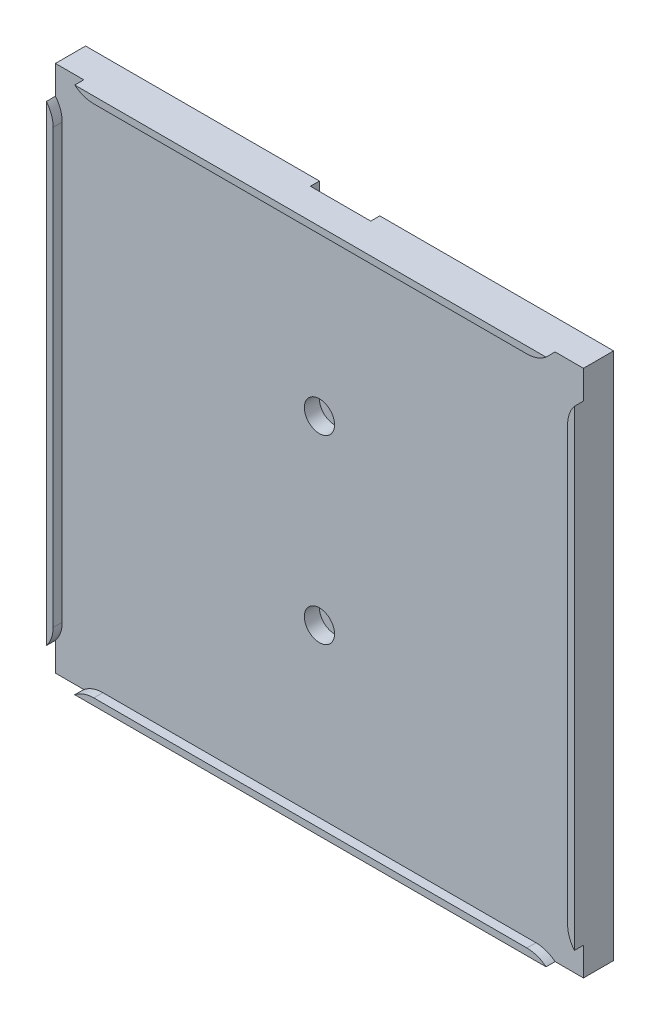
from build123d import *

# Parameters (mm, degrees)
SKETCH_1_W           = 175
SKETCH_1_H           = 175
EXTRUDE_1_DEPTH      = 20
SKETCH_2_W           = 175
SKETCH_2_H           = 175
SKETCH_2_W_2         = 170.15
SKETCH_2_H_2         = 170.15
EXTRUDE_2_DEPTH      = 3
SKETCH_3_R           = 2
CUT_EXTRUDE_1_DEPTH  = 74
SKETCH_4_R           = 5
CUT_EXTRUDE_2_DEPTH  = 5
SKETCH_5_W           = 20
SKETCH_5_H           = 175
CUT_EXTRUDE_3_DEPTH  = 10
CUT_EXTRUDE_4_DEPTH  = 18
OTHER_1_DEPTH        = 18
SKETCH_7_W           = 175
SKETCH_7_H           = 175
CUT_EXTRUDE_5_DEPTH  = 61
SKETCH_9_W           = 20
SKETCH_9_H           = 175
CUT_EXTRUDE_7_DEPTH  = 3
SKETCH_10_W          = 9
SKETCH_10_H          = 169
CUT_EXTRUDE_8_DEPTH  = 9
SKETCH_11_W          = 170.5
SKETCH_11_H          = 170.5
CUT_EXTRUDE_9_DEPTH  = 101
SKETCH_12_R          = 7.5
CUT_EXTRUDE_10_DEPTH = 89
FILLET_1_R           = 10
FILLET_2_R           = 10


# Read off the part's stored shape, not the designer's step: 填充阵列1
with BuildPart() as part:
    # 草图1 → 凸台-拉伸1 (new body)
    with BuildSketch(Plane.XY):
        Rectangle(SKETCH_1_W, SKETCH_1_H)
    extrude(amount=EXTRUDE_1_DEPTH)

    # 草图2 → 凸台-拉伸2 (add)
    with BuildSketch(Plane.XY.offset(20)):
        Rectangle(SKETCH_2_W, SKETCH_2_H)
        Rectangle(SKETCH_2_W_2, SKETCH_2_H_2, mode=Mode.SUBTRACT)
    extrude(amount=EXTRUDE_2_DEPTH)

    # 草图3 → 切除-拉伸1 (cut)
    with BuildSketch(Plane.XY.offset(20)):
        with Locations((0, 30)):
            Circle(SKETCH_3_R)
        with Locations((0, -30)):
            Circle(SKETCH_3_R)
    extrude(amount=-CUT_EXTRUDE_1_DEPTH, mode=Mode.SUBTRACT)

    # 草图4 → 切除-拉伸2 (cut)
    with BuildSketch(Plane.XY.offset(20)):
        with Locations((0, 30)):
            Circle(SKETCH_4_R)
        with Locations((0, -30)):
            Circle(SKETCH_4_R)
    extrude(amount=-CUT_EXTRUDE_2_DEPTH, mode=Mode.SUBTRACT)

    # 草图5 → 切除-拉伸3 (cut)
    with BuildSketch(Plane(origin=(0, 0, 0), x_dir=(-1, 0, 0), z_dir=(0, 0, -1))):
        Rectangle(SKETCH_5_W, SKETCH_5_H)
    extrude(amount=-CUT_EXTRUDE_3_DEPTH, mode=Mode.SUBTRACT)

    # 草图6 → 切除-拉伸4 (cut)
    with BuildSketch(Plane(origin=(0, 0, 0), x_dir=(-1, 0, 0), z_dir=(0, 0, -1))):
        Polygon((40.349883702, 10), (34.57638101, 0), (40.349883702, -10), (51.896889086, -10), (57.670391778, 0), (51.896889086, 10), align=None)
    cut_extrude_4 = extrude(amount=-CUT_EXTRUDE_4_DEPTH, mode=Mode.SUBTRACT)

    # 填充阵列1 outline → 填充阵列1 (cut)
    with BuildSketch(Plane.XY):
        Polygon((-58.536417182, -21.5), (-70.083422566, -21.5), (-75.856925258, -31.5), (-70.083422566, -41.5), (-58.536417182, -41.5), (-52.76291449, -31.5), align=None)
        Polygon((-22.163350223, 41.5), (-33.710355607, 41.5), (-39.483858299, 31.5), (-33.710355607, 21.5), (-22.163350223, 21.5), (-16.389847531, 31.5), align=None)
        Polygon((-33.710355607, -21.5), (-39.483858299, -31.5), (-33.710355607, -41.5), (-22.163350223, -41.5), (-16.389847531, -31.5), (-22.163350223, -21.5), align=None)
        Polygon((-70.083422566, 41.5), (-75.856925258, 31.5), (-70.083422566, 21.5), (-58.536417182, 21.5), (-52.76291449, 31.5), (-58.536417182, 41.5), align=None)
        Polygon((-16.389847531, -73.5), (-22.163350223, -63.5), (-33.710355607, -63.5), (-39.483858299, -73.5), (-33.710355607, -83.5), (-22.163350223, -83.5), align=None)
        Polygon((-52.76291449, -73.5), (-58.536417182, -63.5), (-70.083422566, -63.5), (-75.856925258, -73.5), (-70.083422566, -83.5), (-58.536417182, -83.5), align=None)
        Polygon((-51.896889086, -32), (-57.670391778, -42), (-51.896889086, -52), (-40.349883702, -52), (-34.57638101, -42), (-40.349883702, -32), align=None)
        Polygon((-70.083422566, -0.5), (-75.856925258, -10.5), (-70.083422566, -20.5), (-58.536417182, -20.5), (-52.76291449, -10.5), (-58.536417182, -0.5), align=None)
        Polygon((-34.57638101, 63), (-40.349883702, 73), (-51.896889086, 73), (-57.670391778, 63), (-51.896889086, 53), (-40.349883702, 53), align=None)
        Polygon((-16.389847531, 73.5), (-22.163350223, 83.5), (-33.710355607, 83.5), (-39.483858299, 73.5), (-33.710355607, 63.5), (-22.163350223, 63.5), align=None)
        Polygon((-52.76291449, 73.5), (-58.536417182, 83.5), (-70.083422566, 83.5), (-75.856925258, 73.5), (-70.083422566, 63.5), (-58.536417182, 63.5), align=None)
        Polygon((-40.349883702, 52), (-51.896889086, 52), (-57.670391778, 42), (-51.896889086, 32), (-40.349883702, 32), (-34.57638101, 42), align=None)
        Polygon((-58.536417182, 20.5), (-70.083422566, 20.5), (-75.856925258, 10.5), (-70.083422566, 0.5), (-58.536417182, 0.5), (-52.76291449, 10.5), align=None)
        Polygon((-52.76291449, 52.5), (-58.536417182, 62.5), (-70.083422566, 62.5), (-75.856925258, 52.5), (-70.083422566, 42.5), (-58.536417182, 42.5), align=None)
        Polygon((-16.389847531, 52.5), (-22.163350223, 62.5), (-33.710355607, 62.5), (-39.483858299, 52.5), (-33.710355607, 42.5), (-22.163350223, 42.5), align=None)
        Polygon((-51.896889086, 31), (-57.670391778, 21), (-51.896889086, 11), (-40.349883702, 11), (-34.57638101, 21), (-40.349883702, 31), align=None)
        Polygon((-33.710355607, -0.5), (-39.483858299, -10.5), (-33.710355607, -20.5), (-22.163350223, -20.5), (-16.389847531, -10.5), (-22.163350223, -0.5), align=None)
        Polygon((-33.710355607, 20.5), (-39.483858299, 10.5), (-33.710355607, 0.5), (-22.163350223, 0.5), (-16.389847531, 10.5), (-22.163350223, 20.5), align=None)
        Polygon((-40.349883702, -53), (-51.896889086, -53), (-57.670391778, -63), (-51.896889086, -73), (-40.349883702, -73), (-34.57638101, -63), align=None)
        Polygon((-34.57638101, -21), (-40.349883702, -11), (-51.896889086, -11), (-57.670391778, -21), (-51.896889086, -31), (-40.349883702, -31), align=None)
        Polygon((-58.536417182, -42.5), (-70.083422566, -42.5), (-75.856925258, -52.5), (-70.083422566, -62.5), (-58.536417182, -62.5), (-52.76291449, -52.5), align=None)
        Polygon((-33.710355607, -42.5), (-39.483858299, -52.5), (-33.710355607, -62.5), (-22.163350223, -62.5), (-16.389847531, -52.5), (-22.163350223, -42.5), align=None)
    other_1 = extrude(amount=OTHER_1_DEPTH, mode=Mode.SUBTRACT)

    # 镜向1: 切除-拉伸4, 填充阵列1 across plane
    add(cut_extrude_4.mirror(Plane(origin=(0, 0, 0), x_dir=(0, 0, 1), z_dir=(1, 0, 0))), mode=Mode.SUBTRACT)
    add(other_1.mirror(Plane(origin=(0, 0, 0), x_dir=(0, 0, 1), z_dir=(1, 0, 0))), mode=Mode.SUBTRACT)

    # 草图7 → 切除-拉伸5 (cut)
    with BuildSketch(Plane(origin=(0, 0, 10), x_dir=(-1, 0, 0), z_dir=(0, 0, -1))):
        Rectangle(SKETCH_7_W, SKETCH_7_H)
    extrude(amount=CUT_EXTRUDE_5_DEPTH, mode=Mode.SUBTRACT)

    # 草图9 → 切除-拉伸7 (cut)
    with BuildSketch(Plane(origin=(0, 0, 10), x_dir=(-1, 0, 0), z_dir=(0, 0, -1))):
        Rectangle(SKETCH_9_W, SKETCH_9_H)
    extrude(amount=-CUT_EXTRUDE_7_DEPTH, mode=Mode.SUBTRACT)

    # 草图10 → 切除-拉伸8 (cut)
    with BuildSketch(Plane(origin=(0, 0, 10), x_dir=(-1, 0, 0), z_dir=(0, 0, -1))):
        with Locations((81, 0)):
            Rectangle(SKETCH_10_W, SKETCH_10_H)
    cut_extrude_8 = extrude(amount=-CUT_EXTRUDE_8_DEPTH, mode=Mode.SUBTRACT)

    # 镜向2: 切除-拉伸8 across plane
    add(cut_extrude_8.mirror(Plane(origin=(0, 0, 0), x_dir=(0, 0, 1), z_dir=(1, 0, 0))), mode=Mode.SUBTRACT)

    # 草图11 → 切除-拉伸9 (cut)
    with BuildSketch(Plane.XY.offset(20)):
        Rectangle(SKETCH_11_W, SKETCH_11_H)
    extrude(amount=CUT_EXTRUDE_9_DEPTH, mode=Mode.SUBTRACT)

    # 草图12 → 切除-拉伸10 (cut)
    with BuildSketch(Plane.XY.offset(20)):
        with Locations((85.25, 85.25)):
            Circle(SKETCH_12_R)
        with Locations((-85.25, 85.25)):
            Circle(SKETCH_12_R)
        with Locations((-85.25, -85.25)):
            Circle(SKETCH_12_R)
        with Locations((85.25, -85.25)):
            Circle(SKETCH_12_R)
    extrude(amount=CUT_EXTRUDE_10_DEPTH, mode=Mode.SUBTRACT)

    # 圆角1
    # the kernel refuses this fillet: 10 mm, written as the material it takes off along each edge
    with BuildSketch(Plane(origin=(77.75, -85.25, 37.935390851), x_dir=(0.1517576992825315, -0.9884177258166066, 0), z_dir=(0, 0, -1)), Plane(origin=(85.25, 77.75, 37.935390851), x_dir=(0.9884177258166073, 0.15175769928252728, 0), z_dir=(0, 0, -1))) as fillet_1_piece_1:
        with BuildLine():
            CenterArc((8.977553037, 7.422539017), FILLET_1_R, 188.728801562, 39.194967426)
            Line((-0.906624221, 5.904962024), (-1.104307767, 5.874610484))
            Line((-1.104307767, 5.874610484), (-0.197683545, -0.03035154))
            Line((-0.197683545, -0.03035154), (0.03035154, -0.197683545))
            ThreePointArc((0.03035154, -0.197683545), (1.138182745, -0.113132944), (2.142341738, -0.14845078))
            Line((2.142341738, -0.14845078), (2.276365489, 0))
        make_face()
    extrude(amount=17.935390851, mode=Mode.SUBTRACT)
    with BuildSketch(Plane(origin=(85.25, -77.75, 37.935390851), x_dir=(0.9884177258166066, -0.1517576992825315, 0), z_dir=(0, 0, -1)), Plane(origin=(77.75, 85.25, 37.935390851), x_dir=(0.1517576992825315, 0.9884177258166066, 0), z_dir=(0, 0, -1))) as fillet_1_piece_2:
        with BuildLine():
            CenterArc((8.977553037, -7.422539017), FILLET_1_R, 132.076231012, 39.194967426)
            Line((-0.906624221, -5.904962024), (-1.104307767, -5.874610484))
            Line((-1.104307767, -5.874610484), (-0.197683545, 0.03035154))
            Line((-0.197683545, 0.03035154), (0.03035154, 0.197683545))
            ThreePointArc((0.03035154, 0.197683545), (1.138182745, 0.113132944), (2.142341738, 0.14845078))
            Line((2.142341738, 0.14845078), (2.276365489, 0))
        make_face()
    extrude(amount=17.935390851, mode=Mode.SUBTRACT)

    # 圆角2
    # the kernel refuses this fillet: 10 mm, written as the material it takes off along each edge
    with BuildSketch(Plane(origin=(-85.25, 77.75, 37.935390851), x_dir=(0, -1, 0), z_dir=(0, 0, -1))) as fillet_2_piece_1:
        with BuildLine():
            CenterArc((5.974156341, 10), FILLET_2_R, 230.805032574, 39.194967426)
            Line((-0.345455989, 2.25), (-0.471848236, 2.095))
            ThreePointArc((-0.471848236, 2.095), (-0.284550602, 1.107831205), (-0.2, 0))
            Line((-0.2, 0), (0, -0.2))
            Line((0, -0.2), (5.974156341, -0.2))
            Line((5.974156341, -0.2), (5.974156341, 0))
        make_face()
    extrude(amount=17.935390851, mode=Mode.SUBTRACT)
    with BuildSketch(Plane(origin=(-77.75, 85.25, 20), x_dir=(-0.15175769928253574, 0.988417725816606, 0), z_dir=(0, 0, 1))) as fillet_2_piece_2:
        with BuildLine():
            CenterArc((8.977553037, -7.422539017), FILLET_2_R, 132.076231012, 39.194967426)
            Line((-0.906624221, -5.904962024), (-1.104307767, -5.874610484))
            Line((-1.104307767, -5.874610484), (-0.197683545, 0.03035154))
            Line((-0.197683545, 0.03035154), (0.03035154, 0.197683545))
            ThreePointArc((0.03035154, 0.197683545), (1.138182745, 0.113132944), (2.142341738, 0.14845078))
            Line((2.142341738, 0.14845078), (2.276365489, 0))
        make_face()
    extrude(amount=17.935390851, mode=Mode.SUBTRACT)
    with BuildSketch(Plane(origin=(-77.75, -85.25, 20), x_dir=(1, 0, 0), z_dir=(0, 0, 1))) as fillet_2_piece_3:
        with BuildLine():
            CenterArc((5.974156341, -10), FILLET_2_R, 90, 39.194967426)
            Line((-0.345455989, -2.25), (-0.471848236, -2.095))
            ThreePointArc((-0.471848236, -2.095), (-0.284550602, -1.107831205), (-0.2, 0))
            Line((-0.2, 0), (0, 0.2))
            Line((0, 0.2), (5.974156341, 0.2))
            Line((5.974156341, 0.2), (5.974156341, 0))
        make_face()
    extrude(amount=17.935390851, mode=Mode.SUBTRACT)
    with BuildSketch(Plane(origin=(-85.25, -77.75, 37.935390851), x_dir=(-0.9884177258166066, -0.1517576992825315, 0), z_dir=(0, 0, -1))) as fillet_2_piece_4:
        with BuildLine():
            CenterArc((8.977553037, 7.422539017), FILLET_2_R, 188.728801562, 39.194967426)
            Line((-0.906624221, 5.904962024), (-1.104307767, 5.874610484))
            Line((-1.104307767, 5.874610484), (-0.197683545, -0.03035154))
            Line((-0.197683545, -0.03035154), (0.03035154, -0.197683545))
            ThreePointArc((0.03035154, -0.197683545), (1.138182745, -0.113132944), (2.142341738, -0.14845078))
            Line((2.142341738, -0.14845078), (2.276365489, 0))
        make_face()
    extrude(amount=17.935390851, mode=Mode.SUBTRACT)


solid = part.part
